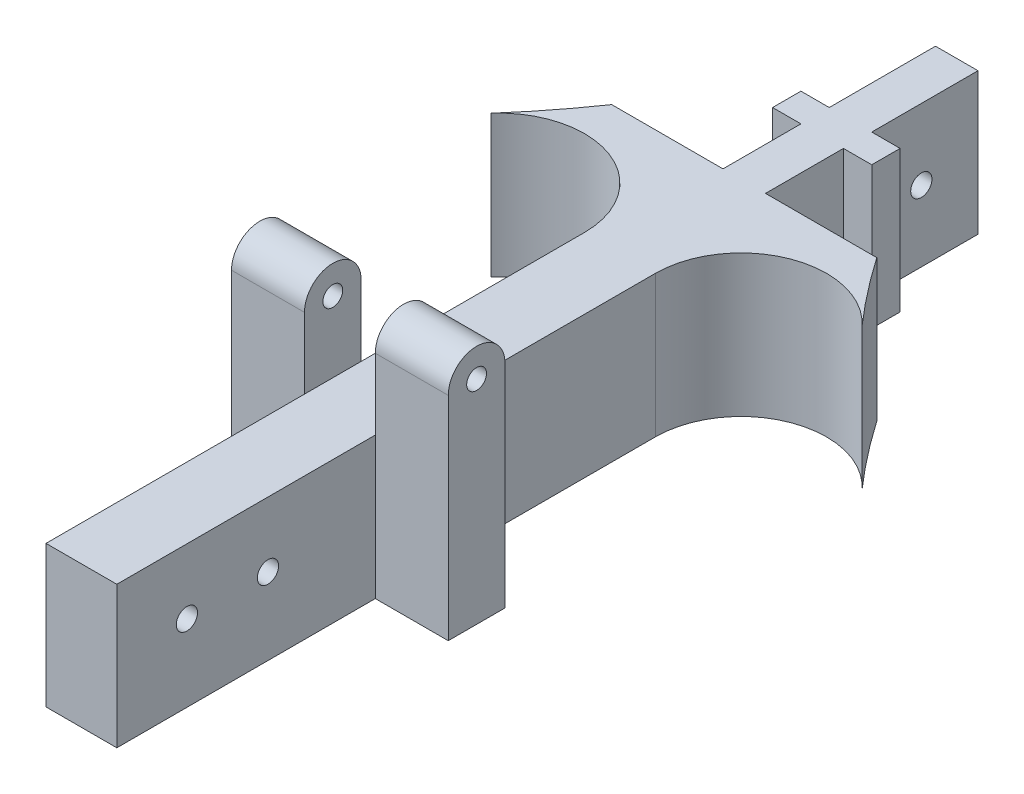
from build123d import *

# Parameters (mm, degrees)
BOSS_EXTRU_1_DEPTH      = 20
ESQUISSE3_R             = 1.5
ENL_V_MAT_EXTRU_3_DEPTH = 20
ESQUISSE4_R             = 1.5
ENL_V_MAT_EXTRU_4_DEPTH = 10
ESQUISSE5_R             = 1.5
ENL_V_MAT_EXTRU_5_DEPTH = 10
ESQUISSE6_R             = 1.4
BOSS_EXTRU_2_DEPTH      = 10.3


with BuildPart() as part:
    # Esquisse1 → Boss.-Extru.1 (new body)
    with BuildSketch(Plane(origin=(0, 0, 0), x_dir=(1, 0, 0), z_dir=(0, 1, 0))):
        with BuildLine():
            Line((-3, 84.398281038), (-3, 69.398281038))
            Line((-3, 69.398281038), (-7, 69.398281038))
            Line((-7, 69.398281038), (-7, 65.398281038))
            Line((-7, 65.398281038), (-3, 65.398281038))
            Line((-3, 65.398281038), (-3, 54.398281038))
            Line((-3, 54.398281038), (-18.71, 54.398281038))
            ThreePointArc((-18.71, 54.398281038), (-22.308577777, 49.499317693), (-26.183329952, 44.81574006))
            ThreePointArc((-26.183329952, 44.81574006), (-12.83252844, 48.159570073), (-5, 36.842476876))
            Line((-5, 36.842476876), (-5, -39.182739587))
            Line((-5, -39.182739587), (0, -39.182739587))
            Line((0, -39.182739587), (0, 84.398281038))
            Line((0, 84.398281038), (-3, 84.398281038))
        make_face()
    boss_extru_1 = extrude(amount=BOSS_EXTRU_1_DEPTH)

    # Symétrie1: Boss.-Extru.1 across plane
    add(boss_extru_1.mirror(Plane(origin=(0, 20, -84.398281038), x_dir=(0, 0, 1), z_dir=(-1, 0, 0))))

    # Esquisse3 → Enlèv. mat.-Extru.3 (cut)
    with BuildSketch(Plane.ZY.offset(3)):
        with Locations((-76.398281038, 10)):
            Circle(ESQUISSE3_R)
        with Locations((-60.398281038, 10)):
            Circle(ESQUISSE3_R)
    extrude(amount=-ENL_V_MAT_EXTRU_3_DEPTH, mode=Mode.SUBTRACT)

    # Esquisse4 → Enlèv. mat.-Extru.4 (cut)
    with BuildSketch(Plane.ZY.offset(5)):
        with Locations((29.291975875, 10.84)):
            Circle(ESQUISSE4_R)
    extrude(amount=-ENL_V_MAT_EXTRU_4_DEPTH, mode=Mode.SUBTRACT)

    # Esquisse5 → Enlèv. mat.-Extru.5 (cut)
    with BuildSketch(Plane.ZY.offset(5)):
        with Locations((17.841975875, 10.84)):
            Circle(ESQUISSE5_R)
    extrude(amount=-ENL_V_MAT_EXTRU_5_DEPTH, mode=Mode.SUBTRACT)

    # Esquisse6 → Boss.-Extru.2 (add)
    with BuildSketch(Plane(origin=(5, 0, 0), x_dir=(0, 0, -1), z_dir=(1, 0, 0))):
        with BuildLine():
            Line((5.308208853, 0), (-2.691791147, 0))
            Line((-2.691791147, 0), (-2.691791147, 30))
            ThreePointArc((-2.691791147, 30), (1.308208853, 34), (5.308208853, 30))
            Line((5.308208853, 30), (5.308208853, 0))
        make_face()
        with Locations((1.308208853, 30)):
            Circle(ESQUISSE6_R, mode=Mode.SUBTRACT)
    boss_extru_2 = extrude(amount=BOSS_EXTRU_2_DEPTH)

    # Symétrie2: Boss.-Extru.2 across plane
    add(boss_extru_2.mirror(Plane.ZY))


solid = part.part
